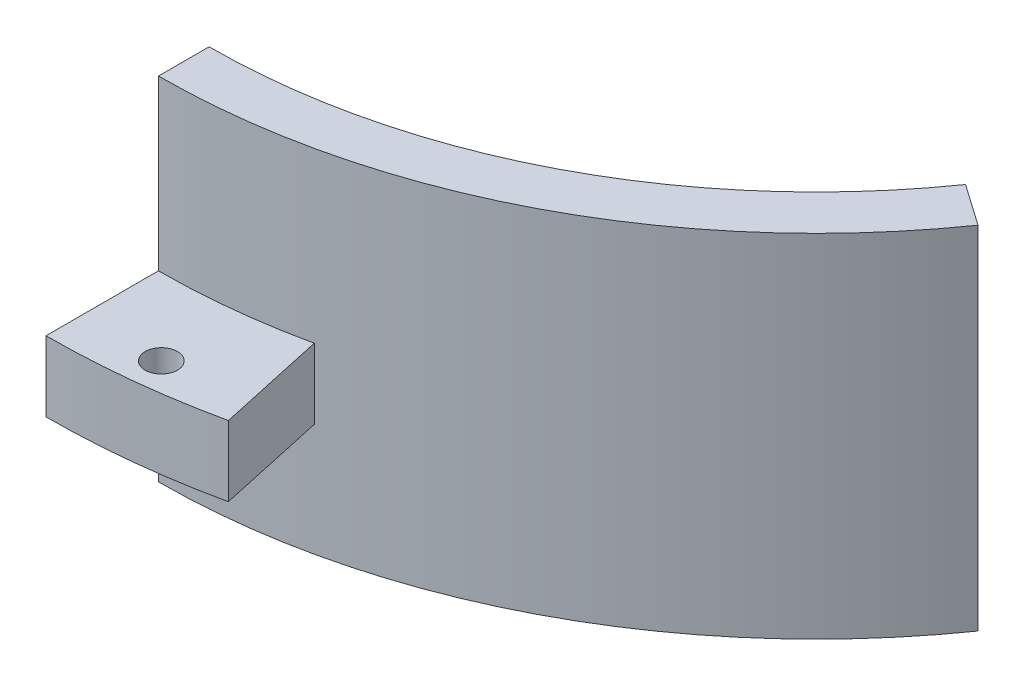
from build123d import *

# Parameters (mm, degrees)
BOSS_EXTRUDE1_DEPTH = 25
BOSS_EXTRUDE2_START = -19
BOSS_EXTRUDE2_DEPTH = 13
BOSS_EXTRUDE3_START = -17
BOSS_EXTRUDE3_DEPTH = 5
M2_HOLES_REACH      = 70.13
SKETCH5_R           = 1.15
CUT_EXTRUDE1_REACH  = 71.525


with BuildPart() as part:
    # Sketch2 → Boss-Extrude1 (new body)
    with BuildSketch(Plane(origin=(0, 0, 0), x_dir=(1, 0, 0), z_dir=(0, 1, 0))):
        with BuildLine():
            Line((0, -43.2), (0, -46.8))
            ThreePointArc((0, -46.8), (21.609835099, -41.512106993), (38.336315673, -26.843377221))
            Line((38.336315673, -26.843377221), (35.387368313, -24.77850205))
            ThreePointArc((35.387368313, -24.77850205), (19.947540092, -38.318867993), (0, -43.2))
        make_face()
    extrude(amount=BOSS_EXTRUDE1_DEPTH)

    # Sketch3 → Boss-Extrude2 (add)
    with BuildSketch(Plane(origin=(0, 25, 0), x_dir=(1, 0, 0), z_dir=(0, 1, 0)).offset(BOSS_EXTRUDE2_START)):
        with BuildLine():
            Line((0, -40), (0, -43.2))
            ThreePointArc((0, -43.2), (19.947540092, -38.318867993), (35.387368313, -24.77850205))
            Line((35.387368313, -24.77850205), (32.766081772, -22.943057454))
            ThreePointArc((32.766081772, -22.943057454), (18.469944529, -35.480433327), (0, -40))
        make_face()
    extrude(amount=BOSS_EXTRUDE2_DEPTH)

    # Sketch4 → Boss-Extrude3 (add)
    with BuildSketch(Plane(origin=(0, 25, 0), x_dir=(1, 0, 0), z_dir=(0, 1, 0)).offset(BOSS_EXTRUDE3_START)):
        with BuildLine():
            ThreePointArc((10, -45.719142599), (5.029121512, -46.52900103), (0, -46.8))
            Line((0, -46.8), (0, -54.8))
            ThreePointArc((0, -54.8), (5.888800403, -54.482676419), (11.709401709, -53.53438065))
            Line((11.709401709, -53.53438065), (10, -45.719142599))
        make_face()
    extrude(amount=BOSS_EXTRUDE3_DEPTH)

    # Sketch5 → M2 holes (cut, up to next)
    with BuildSketch(Plane(origin=(0, 13, 0), x_dir=(1, 0, 0), z_dir=(0, 1, 0)), mode=Mode.PRIVATE) as m2_holes_sk1:
        with Locations((5.647015715, -52.245705216)):
            Circle(SKETCH5_R)
    m2_holes_tool1 = extrude(m2_holes_sk1.sketch, amount=-M2_HOLES_REACH, mode=Mode.PRIVATE) & part.part
    add(m2_holes_tool1.solids().sort_by_distance((5.647016, 13, 52.245705))[0], mode=Mode.SUBTRACT)

    # Sketch6 → Cut-Extrude1 (cut, up to next)
    with BuildSketch(Plane(origin=(0, 19, 0), x_dir=(1, 0, 0), z_dir=(0, 1, 0)), mode=Mode.PRIVATE) as cut_extrude1_sk1:
        with BuildLine():
            Line((0, -40), (0, -43))
            Line((0, -43), (5, -39.686269666))
            ThreePointArc((5, -39.686269666), (2.504916502, -39.921490369), (0, -40))
        make_face()
    cut_extrude1_tool1 = extrude(cut_extrude1_sk1.sketch, amount=-CUT_EXTRUDE1_REACH, mode=Mode.PRIVATE) & part.part
    add(cut_extrude1_tool1.solids().sort_by_distance((1.636399, 19, 40.932418))[0], mode=Mode.SUBTRACT)


solid = part.part
